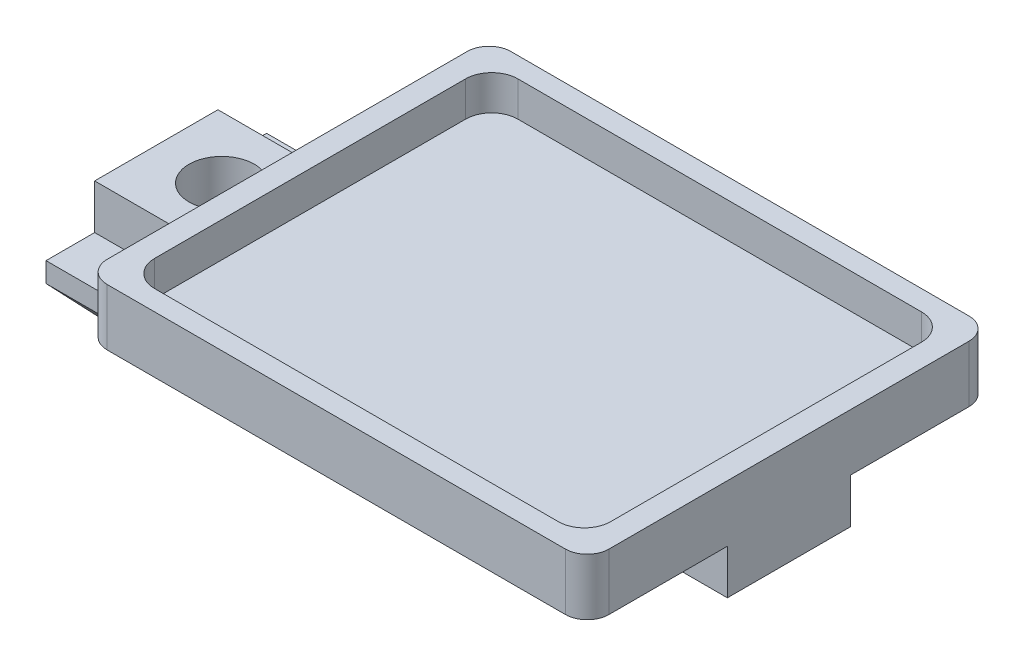
from build123d import *

# Parameters (mm, degrees)
SKETCH1_W           = 23
SKETCH1_H           = 18.5
BOSS_EXTRUDE1_DEPTH = 1
FILLET1_R           = 1
BOSS_EXTRUDE2_START = 1.6
BOSS_EXTRUDE2_DEPTH = 1.6
BOSS_EXTRUDE3_DEPTH = 17.5
BOSS_EXTRUDE4_DEPTH = 11.5
FILLET2_R           = 6
SKETCH5_R           = 1.5
CUT_EXTRUDE1_DEPTH  = 9
SKETCH6_R           = 1.85
CUT_EXTRUDE3_DEPTH  = 3


with BuildPart() as part:
    # Sketch1 → Boss-Extrude1 (new body)
    with BuildSketch(Plane(origin=(0, 0, 0), x_dir=(1, 0, 0), z_dir=(0, 1, 0))):
        Rectangle(SKETCH1_W, SKETCH1_H)
    extrude(amount=BOSS_EXTRUDE1_DEPTH)

    # Fillet1
    fillet1_edges = [part.edges().sort_by_distance(p)[0] for p in [
        (11.5, 0.5, 9.25),
        (-11.5, 0.5, 9.25),
        (-11.5, 0.5, -9.25),
        (11.5, 0.5, -9.25),
    ]]
    fillet(fillet1_edges, radius=FILLET1_R)

    # Sketch2 → Boss-Extrude2 (add)
    with BuildSketch(Plane(origin=(0, 1, 0), x_dir=(1, 0, 0), z_dir=(0, 1, 0)).offset(BOSS_EXTRUDE2_START)):
        with BuildLine():
            Line((10.5, 9.25), (-10.5, 9.25))
            ThreePointArc((-10.5, 9.25), (-11.207106781, 8.957106781), (-11.5, 8.25))
            Line((-11.5, 8.25), (-11.5, -8.25))
            ThreePointArc((-11.5, -8.25), (-11.207106781, -8.957106781), (-10.5, -9.25))
            Line((-10.5, -9.25), (10.5, -9.25))
            ThreePointArc((10.5, -9.25), (11.207106781, -8.957106781), (11.5, -8.25))
            Line((11.5, -8.25), (11.5, 8.25))
            ThreePointArc((11.5, 8.25), (11.207106781, 8.957106781), (10.5, 9.25))
        make_face()
        with BuildLine():
            Line((9.25, 8.325), (-9.25, 8.325))
            ThreePointArc((-9.25, 8.325), (-10.098528137, 7.973528137), (-10.45, 7.125))
            Line((-10.45, 7.125), (-10.45, -7.125))
            ThreePointArc((-10.45, -7.125), (-10.098528137, -7.973528137), (-9.25, -8.325))
            Line((-9.25, -8.325), (9.25, -8.325))
            ThreePointArc((9.25, -8.325), (10.098528137, -7.973528137), (10.45, -7.125))
            Line((10.45, -7.125), (10.45, 7.125))
            ThreePointArc((10.45, 7.125), (10.098528137, 7.973528137), (9.25, 8.325))
        make_face(mode=Mode.SUBTRACT)
    extrude(amount=-BOSS_EXTRUDE2_DEPTH)

    # Sketch3 → Boss-Extrude3 (add)
    with BuildSketch(Plane(origin=(0, 0, 0), x_dir=(0, 0, -1), z_dir=(1, 0, 0))):
        Polygon((-2.824998215, -0.434236645), (-2.824998215, 0), (2.825004114, 0), (2.825004114, -0.52086856), (2.825004485, -2.050001378), (5.054655907, -2.050000837), (5.054655907, -3.096446609), (2.301102516, -5.85), (-2.297621726, -5.85), (-5.054652336, -2.959512633), (-5.054652336, -2.05), (-2.824998215, -2.05), align=None)
    extrude(amount=-BOSS_EXTRUDE3_DEPTH)

    # Sketch4 → Boss-Extrude4 (add)
    with BuildSketch(Plane(origin=(0, 0, 0), x_dir=(0, 0, -1), z_dir=(1, 0, 0))):
        Polygon((-2.824998215, -2.05), (2.825004485, -2.050001378), (2.825004114, 0), (-2.824998215, 0), align=None)
    extrude(amount=BOSS_EXTRUDE4_DEPTH)

    # Fillet2
    # the kernel refuses this fillet: 6 mm, written as the material it takes off along each edge
    with BuildSketch(Plane(origin=(0, -5.85, -16.256387574), x_dir=(0, 1, 0), z_dir=(0, 0, 1))) as fillet2_piece_1:
        with BuildLine():
            CenterArc((6, 5.582114023), FILLET2_R, 180, 68.489804657)
            Line((0, 5.582114023), (-0.12, 5.582114023))
            Line((-0.12, 5.582114023), (-0.12, 0))
            Line((-0.12, 0), (0, -0.12))
            ThreePointArc((0, -0.12), (1.899999655, -0.12), (3.755999297, -0.11164228))
            Line((3.755999297, -0.11164228), (3.799999311, 0))
        make_face()
    extrude(amount=32.509294358, mode=Mode.SUBTRACT)

    # Sketch5 → Cut-Extrude1 (cut)
    with BuildSketch(Plane(origin=(0, 0, 0), x_dir=(1, 0, 0), z_dir=(0, 1, 0))):
        with Locations(Location((-14.5, 0, 0), (0, 0, 270))):
            Circle(SKETCH5_R)
    extrude(amount=-CUT_EXTRUDE1_DEPTH, mode=Mode.SUBTRACT)

    # Sketch6 → Cut-Extrude3 (cut)
    with BuildSketch(Plane.XZ.offset(5.85)):
        with Locations(Location((-14.5, 0, 0), (0, 0, 270))):
            Circle(SKETCH6_R)
    extrude(amount=-CUT_EXTRUDE3_DEPTH, mode=Mode.SUBTRACT)


solid = part.part
